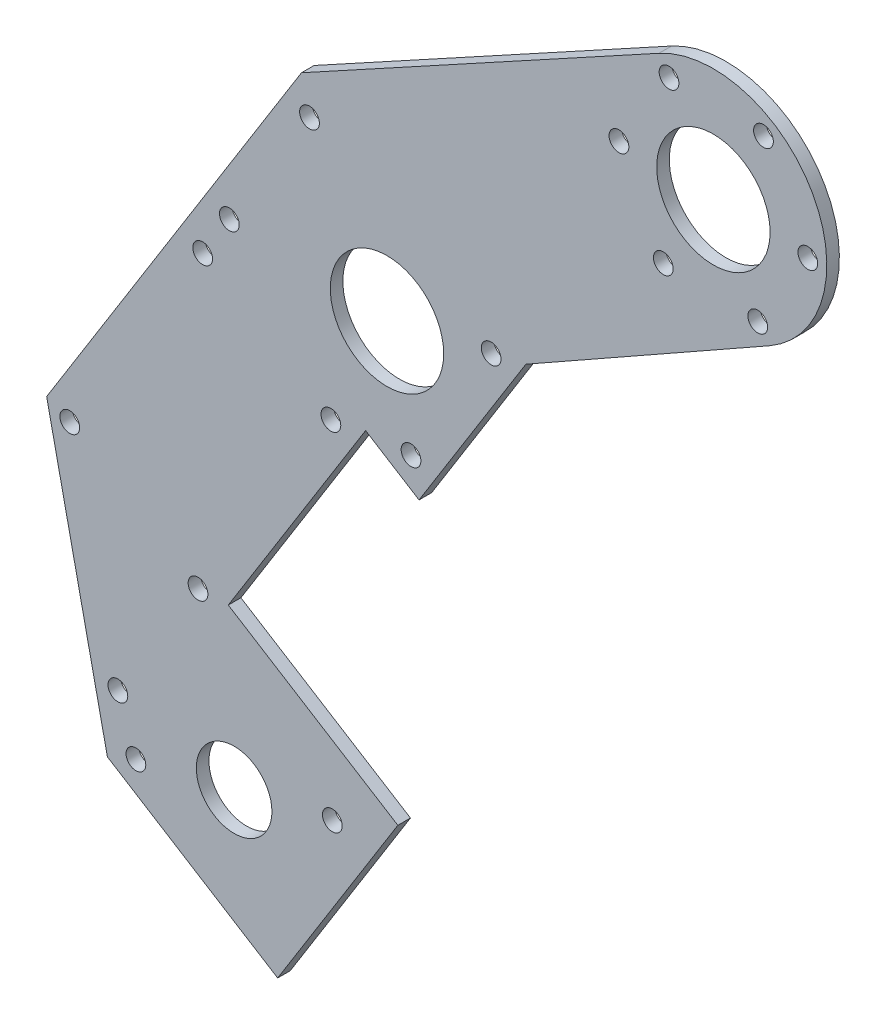
from build123d import *

# Parameters (mm, degrees)
SKETCH1_R              = 14.2875
SKETCH1_R_2            = 9.525
BOSS_EXTRUDE1_DEPTH    = 3.175
F_10_CLEARANCE_HOLE2_D = 4.9784
F_10_CLEARANCE_HOLE3_D = 4.9784


with BuildPart() as part:
    # Sketch1 → Boss-Extrude1 (new body)
    with BuildSketch(Plane.XY.offset(-14.194599474)):
        with BuildLine():
            Line((-11.403602879, 461.040918113), (18.881283072, 509.506866808))
            Line((18.881283072, 509.506866808), (-23.846467356, 536.206128526))
            Line((-23.846467356, 536.206128526), (10.759214603, 591.586796266))
            Line((10.759214603, 591.586796266), (24.22197813, 583.174327946))
            Line((24.22197813, 583.174327946), (51.141876753, 626.255171231))
            Line((51.141876753, 626.255171231), (112.462044501, 660.93728694))
            ThreePointArc((112.462044501, 660.93728694), (123.365099157, 699.702028841), (84.677956887, 710.877306848))
            Line((84.677956887, 710.877306848), (-5.401730059, 661.587538174))
            Line((-5.401730059, 661.587538174), (-69.615486106, 558.824047132))
            Line((-69.615486106, 558.824047132), (-54.307899735, 487.850498283))
            Line((-54.307899735, 487.850498283), (-11.403602879, 461.040918113))
        make_face()
        with Locations((16.14150623, 618.174698631)):
            Circle(SKETCH1_R, mode=Mode.SUBTRACT)
        with Locations((-22.373657227, 496.622766323)):
            Circle(SKETCH1_R_2, mode=Mode.SUBTRACT)
        with Locations((98.394472266, 685.809641802)):
            Circle(SKETCH1_R, mode=Mode.SUBTRACT)
    extrude(amount=BOSS_EXTRUDE1_DEPTH)

    # #10 Clearance Hole2 (through all)
    with Locations(Plane.XY.offset(-11.019599474)):
        with Locations((2.375342418, 502.336523103), (-47.122656873, 490.909009542), (-3.381611976, 652.837445435), (42.391784014, 624.235053148), (22.201860047, 591.924420685), (-23.571535943, 620.526812972), (-31.474844299, 535.981130963), (-63.785476762, 556.17105493), (-51.664768266, 503.670498499), (2.009121865, 589.566678183), (-30.301510599, 609.756602151)):
            Hole(F_10_CLEARANCE_HOLE2_D / 2)

    # #10 Clearance Hole3 (through all)
    with Locations(Plane.XY.offset(-11.019599474)):
        with Locations((111.013174745, 706.003787092), (122.192466334, 684.978597537), (109.573763855, 664.784452247), (85.775769786, 665.615496512), (74.596478197, 686.640686067), (87.215180677, 706.834831357)):
            Hole(F_10_CLEARANCE_HOLE3_D / 2)


solid = part.part
